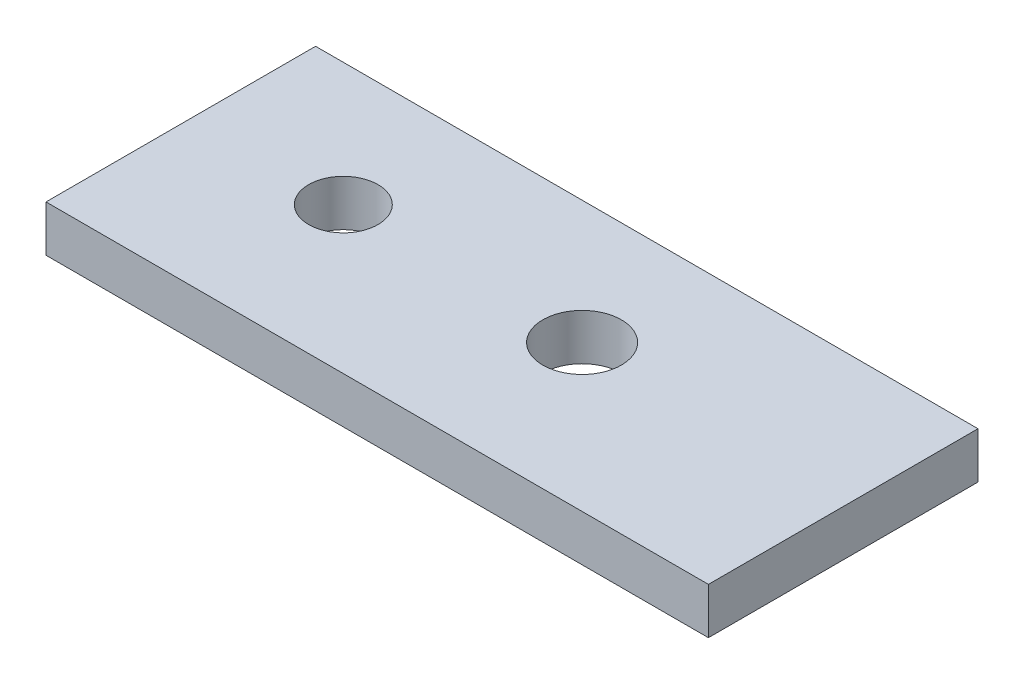
from build123d import *

# Parameters (mm, degrees)
SKETCH1_W           = 86
SKETCH1_H           = 35
BOSS_EXTRUDE1_DEPTH = 6
SKETCH2_R           = 5.1
SKETCH2_R_2         = 4.5
CUT_EXTRUDE1_DEPTH  = 6


with BuildPart() as part:
    # Sketch1 → Boss-Extrude1 (new body)
    with BuildSketch(Plane(origin=(0, 0, 0), x_dir=(1, 0, 0), z_dir=(0, 1, 0))):
        with Locations((43, 17.5)):
            Rectangle(SKETCH1_W, SKETCH1_H)
    extrude(amount=BOSS_EXTRUDE1_DEPTH)

    # Sketch2 → Cut-Extrude1 (cut)
    with BuildSketch(Plane(origin=(0, 6, 0), x_dir=(1, 0, 0), z_dir=(0, 1, 0))):
        with Locations((50.6, 19)):
            Circle(SKETCH2_R)
        with Locations((19.6, 19)):
            Circle(SKETCH2_R_2)
    extrude(amount=-CUT_EXTRUDE1_DEPTH, mode=Mode.SUBTRACT)


solid = part.part
